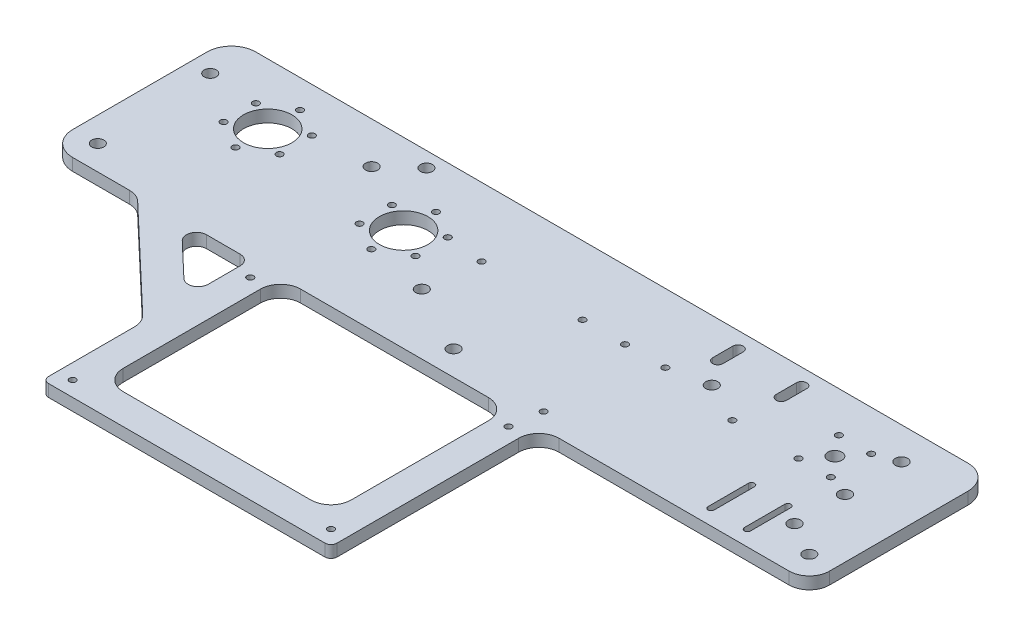
from build123d import *

# Parameters (mm, degrees)
ESBO_O1_R                = 1.6
ESBO_O1_R_2              = 3
ESBO_O1_R_3              = 12
ESBO_O1_R_4              = 3.5
ESBO_O1_R_5              = 3.05
RESSALTO_EXTRUS_O1_DEPTH = 6


with BuildPart() as part:
    # Esboço1 → Ressalto-extrusão1 (new body)
    with BuildSketch(Plane(origin=(0, 0, 0), x_dir=(1, 0, 0), z_dir=(0, 1, 0))):
        with BuildLine():
            Line((-85.527922956, -153.648697641), (51.472077044, -153.648697641))
            ThreePointArc((51.472077044, -153.648697641), (53.593397388, -152.770017984), (54.472077044, -150.648697641))
            Line((54.472077044, -150.648697641), (54.472077044, -60.648697641))
            ThreePointArc((54.472077044, -60.648697641), (57.401009232, -53.577629829), (64.472077044, -50.648697641))
            Line((64.472077044, -50.648697641), (178.527922956, -50.648697641))
            ThreePointArc((178.527922956, -50.648697641), (185.598990768, -47.719765453), (188.527922956, -40.648697641))
            Line((188.527922956, -40.648697641), (188.527922956, 28))
            ThreePointArc((188.527922956, 28), (185.01320433, 36.485281374), (176.527922956, 40))
            Line((176.527922956, 40), (-176.527922956, 40))
            ThreePointArc((-176.527922956, 40), (-185.01320433, 36.485281374), (-188.527922956, 28))
            Line((-188.527922956, 28), (-188.527922956, -38.648697641))
            ThreePointArc((-188.527922956, -38.648697641), (-185.01320433, -47.133979015), (-176.527922956, -50.648697641))
            Line((-176.527922956, -50.648697641), (-148.465622565, -50.648697641))
            ThreePointArc((-148.465622565, -50.648697641), (-144.756883762, -51.361865216), (-141.57713541, -53.399646343))
            Line((-141.57713541, -53.399646343), (-91.639435801, -100.853470046))
            ThreePointArc((-91.639435801, -100.853470046), (-89.338666415, -104.158213518), (-88.527922956, -108.102521344))
            Line((-88.527922956, -108.102521344), (-88.527922956, -150.648697641))
            ThreePointArc((-88.527922956, -150.648697641), (-87.649243299, -152.770017984), (-85.527922956, -153.648697641))
        make_face()
        with Locations((-81.027922956, -58.148697641)):
            Circle(ESBO_O1_R, mode=Mode.SUBTRACT)
        with Locations((-81.027922956, -146.148697641)):
            Circle(ESBO_O1_R, mode=Mode.SUBTRACT)
        with Locations((46.972077044, -58.148697641)):
            Circle(ESBO_O1_R, mode=Mode.SUBTRACT)
        with Locations((46.972077044, -146.148697641)):
            Circle(ESBO_O1_R, mode=Mode.SUBTRACT)
        with Locations((176.311042956, -38.431817641)):
            Circle(ESBO_O1_R_2, mode=Mode.SUBTRACT)
        with Locations((0, -38.431817641)):
            Circle(ESBO_O1_R_2, mode=Mode.SUBTRACT)
        with Locations((-140.527922956, 10)):
            Circle(ESBO_O1_R_3, mode=Mode.SUBTRACT)
        with Locations((-140.527922956, -6)):
            Circle(ESBO_O1_R, mode=Mode.SUBTRACT)
        with Locations((-154.384329416, 2)):
            Circle(ESBO_O1_R, mode=Mode.SUBTRACT)
        with Locations((-154.384329416, 18)):
            Circle(ESBO_O1_R, mode=Mode.SUBTRACT)
        with Locations((-84.367438628, 32.5)):
            Circle(ESBO_O1_R_2, mode=Mode.SUBTRACT)
        with Locations((-176.311042956, -38.431817641)):
            Circle(ESBO_O1_R_2, mode=Mode.SUBTRACT)
        with Locations((140.527922956, 10)):
            Circle(ESBO_O1_R_4, mode=Mode.SUBTRACT)
        with Locations((148.527922956, 0)):
            Circle(ESBO_O1_R, mode=Mode.SUBTRACT)
        with Locations((148.527922956, 20)):
            Circle(ESBO_O1_R, mode=Mode.SUBTRACT)
        with Locations((132.527922956, 0)):
            Circle(ESBO_O1_R, mode=Mode.SUBTRACT)
        with Locations((132.527922956, 20)):
            Circle(ESBO_O1_R, mode=Mode.SUBTRACT)
        with Locations((-140.527922956, 26)):
            Circle(ESBO_O1_R, mode=Mode.SUBTRACT)
        with Locations((-126.671516495, 18)):
            Circle(ESBO_O1_R, mode=Mode.SUBTRACT)
        with Locations((-126.671516495, 2)):
            Circle(ESBO_O1_R, mode=Mode.SUBTRACT)
        with Locations((-63.17160518, -16)):
            Circle(ESBO_O1_R, mode=Mode.SUBTRACT)
        with Locations((-77.02801164, -8)):
            Circle(ESBO_O1_R, mode=Mode.SUBTRACT)
        with Locations((-77.02801164, 8)):
            Circle(ESBO_O1_R, mode=Mode.SUBTRACT)
        with Locations((-63.17160518, 16)):
            Circle(ESBO_O1_R, mode=Mode.SUBTRACT)
        with Locations((-49.315198719, 8)):
            Circle(ESBO_O1_R, mode=Mode.SUBTRACT)
        with Locations((-49.315198719, -8)):
            Circle(ESBO_O1_R, mode=Mode.SUBTRACT)
        with Locations((-63.17160518, 0)):
            Circle(ESBO_O1_R_3, mode=Mode.SUBTRACT)
        with Locations((-33.527922956, -20.648697641)):
            Circle(ESBO_O1_R_2, mode=Mode.SUBTRACT)
        with Locations((79.527922956, 10)):
            Circle(ESBO_O1_R_2, mode=Mode.SUBTRACT)
        with Locations((99.722077044, 0)):
            Circle(ESBO_O1_R, mode=Mode.SUBTRACT)
        with Locations((49.222077044, -43)):
            Circle(ESBO_O1_R, mode=Mode.SUBTRACT)
        with Locations((-30.527922956, 6)):
            Circle(ESBO_O1_R, mode=Mode.SUBTRACT)
        with Locations((19.472077044, 6)):
            Circle(ESBO_O1_R, mode=Mode.SUBTRACT)
        with Locations((60.527922956, 6)):
            Circle(ESBO_O1_R, mode=Mode.SUBTRACT)
        with Locations((40.527922956, 6)):
            Circle(ESBO_O1_R, mode=Mode.SUBTRACT)
        with Locations((159.467922956, 24.07)):
            Circle(ESBO_O1_R_5, mode=Mode.SUBTRACT)
        with Locations((159.467922956, -3.93)):
            Circle(ESBO_O1_R_5, mode=Mode.SUBTRACT)
        with Locations((159.467922956, -28.93)):
            Circle(ESBO_O1_R_5, mode=Mode.SUBTRACT)
        with Locations((-178.527922956, 19.5)):
            Circle(ESBO_O1_R_2, mode=Mode.SUBTRACT)
        with Locations((-98.527922956, 19.5)):
            Circle(ESBO_O1_R_2, mode=Mode.SUBTRACT)
        with BuildLine():
            Line((-110.176410786, -50.648697641), (-93.527922956, -50.648697641))
            ThreePointArc((-93.527922956, -50.648697641), (-89.99238905, -52.113163735), (-88.527922956, -55.648697641))
            Line((-88.527922956, -55.648697641), (-88.527922956, -71.469098112))
            ThreePointArc((-88.527922956, -71.469098112), (-91.555769043, -76.063726382), (-96.972166533, -75.09362376))
            Line((-96.972166533, -75.09362376), (-113.620654363, -59.27322329))
            ThreePointArc((-113.620654363, -59.27322329), (-114.819826998, -53.794328239), (-110.176410786, -50.648697641))
        make_face(mode=Mode.SUBTRACT)
        with BuildLine():
            Line((39.472077044, -60.648697641), (39.472077044, -128.648697641))
            ThreePointArc((39.472077044, -128.648697641), (36.543144856, -135.719765453), (29.472077044, -138.648697641))
            Line((29.472077044, -138.648697641), (-63.527922956, -138.648697641))
            ThreePointArc((-63.527922956, -138.648697641), (-70.598990768, -135.719765453), (-73.527922956, -128.648697641))
            Line((-73.527922956, -128.648697641), (-73.527922956, -60.648697641))
            ThreePointArc((-73.527922956, -60.648697641), (-70.598990768, -53.577629829), (-63.527922956, -50.648697641))
            Line((-63.527922956, -50.648697641), (29.472077044, -50.648697641))
            ThreePointArc((29.472077044, -50.648697641), (36.543144856, -53.577629829), (39.472077044, -60.648697641))
        make_face(mode=Mode.SUBTRACT)
        with BuildLine():
            Line((148.722077044, -43), (148.722077044, -23))
            ThreePointArc((148.722077044, -23), (150.222077044, -21.5), (151.722077044, -23))
            Line((151.722077044, -23), (151.722077044, -43))
            ThreePointArc((151.722077044, -43), (150.222077044, -44.5), (148.722077044, -43))
        make_face(mode=Mode.SUBTRACT)
        with BuildLine():
            Line((133.722077044, -43), (133.722077044, -23))
            ThreePointArc((133.722077044, -23), (132.222077044, -21.5), (130.722077044, -23))
            Line((130.722077044, -23), (130.722077044, -43))
            ThreePointArc((130.722077044, -43), (132.222077044, -44.5), (133.722077044, -43))
        make_face(mode=Mode.SUBTRACT)
        with BuildLine():
            Line((67.977922956, 22), (67.977922956, 32))
            ThreePointArc((67.977922956, 32), (70.527922956, 34.55), (73.077922956, 32))
            Line((73.077922956, 32), (73.077922956, 22))
            ThreePointArc((73.077922956, 22), (70.527922956, 19.45), (67.977922956, 22))
        make_face(mode=Mode.SUBTRACT)
        with BuildLine():
            Line((99.477922956, 22), (99.477922956, 32))
            ThreePointArc((99.477922956, 32), (102.027922956, 34.55), (104.577922956, 32))
            Line((104.577922956, 32), (104.577922956, 22))
            ThreePointArc((104.577922956, 22), (102.027922956, 19.45), (99.477922956, 22))
        make_face(mode=Mode.SUBTRACT)
    extrude(amount=-RESSALTO_EXTRUS_O1_DEPTH)


solid = part.part
